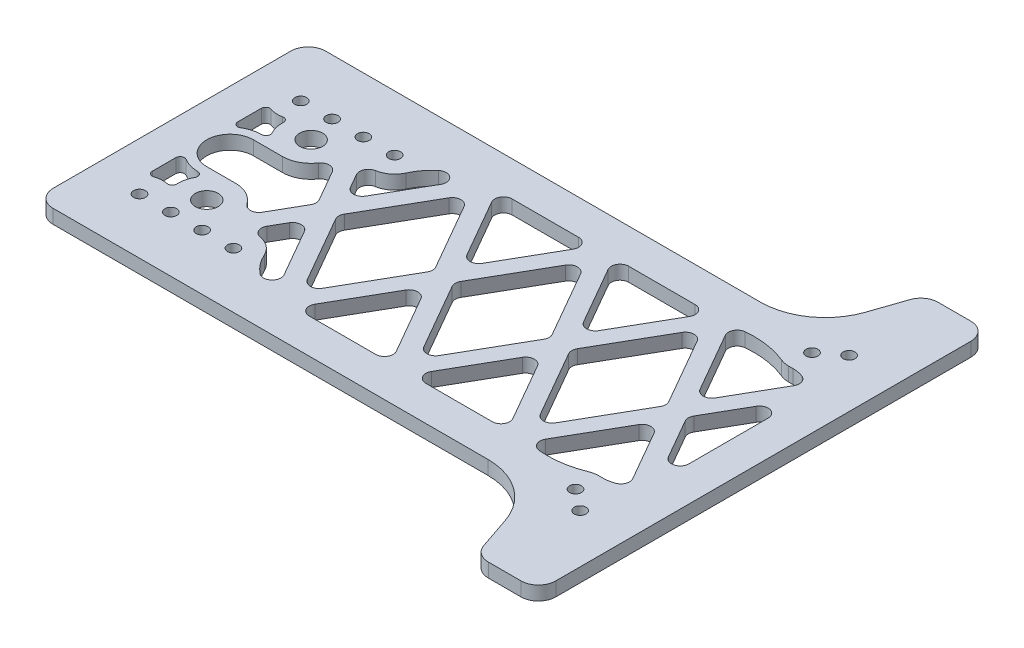
from build123d import *

# Parameters (mm, degrees)
SKETCH2_W               = 170
SKETCH2_H               = 149
BOSS_EXTRUDE1_DEPTH     = 4
M3_CLEARANCE_HOLE1_D    = 3.4
CUT_EXTRUDE4_DEPTH      = 114.09840847686584
CUT_EXTRUDE4_DEPTH_BACK = 114.09840847686584
M6_CLEARANCE_HOLE1_D    = 6.6
FILLET1_R               = 5
CUT_EXTRUDE5_DEPTH      = 10
FILLET2_R               = 2.5
FILLET3_R               = 1.25


with BuildPart() as part:
    # Sketch2 → Boss-Extrude1 (new body)
    with BuildSketch(Plane(origin=(0, 0, 0), x_dir=(1, 0, 0), z_dir=(0, 1, 0))):
        Rectangle(SKETCH2_W, SKETCH2_H)
    extrude(amount=BOSS_EXTRUDE1_DEPTH)

    # M3 Clearance Hole1 (through all)
    with Locations(Plane(origin=(0, 4, 0), x_dir=(1, 0, 0), z_dir=(0, 1, 0))):
        with Locations((-71.16, -23.18), (-62.16, -23.18), (-53.16, -23.18), (-44.16, -23.18), (71, -38.66), (65, -34)):
            m3_clearance_hole1 = Hole(M3_CLEARANCE_HOLE1_D / 2)

    # Mirror1: M3 Clearance Hole1 across plane
    add(m3_clearance_hole1.mirror(Plane.XY), mode=Mode.SUBTRACT)

    # Sketch12 → Cut-Extrude4 (cut, two sides: drawn at the far end of the back side and taken through both)
    with BuildSketch(Plane(origin=(0, 0, 0), x_dir=(1, 0, 0), z_dir=(0, 1, 0)).offset(-CUT_EXTRUDE4_DEPTH_BACK)):
        with BuildLine():
            Line((-85, 74.5), (-85, 39.16087466715528))
            Line((-85, 39.16087466715528), (45, 39.16087466715528))
            ThreePointArc((45.00000000000001, 39.160874667155284), (55.859105017335985, 42.64944779860569), (62.654667985072194, 51.80972226078975))
            Line((62.65466798507219, 51.80972226078975), (67.01941373117832, 64.6605523783211))
            Line((67.01941373117832, 64.6605523783211), (85, 64.6605523783211))
            Line((85, 64.66055237832109), (85, 74.5))
            Line((85, 74.5), (-85, 74.5))
        make_face()
        with BuildLine():
            Line((45, -39.16087466715528), (-85, -39.16087466715528))
            Line((-85, -39.16087466715527), (-85, -74.5))
            Line((-85, -74.5), (85, -74.5))
            Line((85, -74.5), (85, -64.6605523783211))
            Line((85, -64.6605523783211), (67.01941373117832, -64.6605523783211))
            Line((67.01941373117832, -64.6605523783211), (62.65466798507219, -51.80972226078975))
            ThreePointArc((62.654667985072194, -51.80972226078975), (55.859105017335985, -42.64944779860569), (45.00000000000001, -39.160874667155284))
        make_face()
    extrude(amount=CUT_EXTRUDE4_DEPTH + CUT_EXTRUDE4_DEPTH_BACK, mode=Mode.SUBTRACT)

    # M6 Clearance Hole1 (through all)
    with Locations(Plane(origin=(0, 4, 0), x_dir=(1, 0, 0), z_dir=(0, 1, 0))):
        with Locations((-60, -15), (-60, 15)):
            Hole(M6_CLEARANCE_HOLE1_D / 2)

    # Fillet1
    fillet1_edges = [part.edges().sort_by_distance(p)[0] for p in [
        (67.01941373117832, 2, 64.6605523783211),
        (85, 2, 64.6605523783211),
        (-85, 2, 39.16087466715527),
        (-85, 2, -39.16087466715528),
        (85, 2, -64.66055237832109),
        (67.01941373117832, 2, -64.6605523783211),
    ]]
    fillet(fillet1_edges, radius=FILLET1_R)

    # Sketch15 → Cut-Extrude5 (cut)
    with BuildSketch(Plane(origin=(0, 4, 0), x_dir=(1, 0, 0), z_dir=(0, 1, 0))):
        with BuildLine():
            ThreePointArc((62.469658143548614, -27.7961810076784), (63.710734171816135, -27.42521531726875), (65.00000000000001, -27.29999999999999))
            Line((65.00000000000001, -27.299999999999997), (66.24062764020537, -27.299999999999994))
            ThreePointArc((66.24062764020537, -27.299999999999997), (69.21314707767489, -26.780210902203514), (71.8328825180451, -25.28253312150752))
            Line((71.83288251804524, -25.282533121507466), (60.19274779943672, -5.019022315518903))
            Line((60.19274779943672, -5.01902231551891), (46.307592819814715, -29.190734651682497))
            ThreePointArc((46.30759281981484, -29.190734651682643), (47.684415937903765, -29.28693381897562), (49.05500720115354, -29.449339999262378))
            ThreePointArc((49.05500720115355, -29.449339999262378), (55.87235435865291, -29.515537620097643), (62.469658143548614, -27.796181007678403))
        make_face()
        with BuildLine():
            Line((63.07586595540194, 2.842e-14), (74.79873715280104, -20.40754105757501))
            ThreePointArc((74.79873715280098, -20.407541057575024), (74.94953893996781, -19.479492971551863), (75.00000000000001, -18.54062764020535))
            Line((75.00000000000001, -18.54062764020535), (75.00000000000001, 18.54062764020535))
            ThreePointArc((75.00000000000001, 18.54062764020535), (74.94953893996782, 19.47949297155183), (74.798737152801, 20.407541057574967))
            Line((74.79873715280097, 20.407541057574967), (63.07586595540193, 2.842e-14))
        make_face()
        Polygon((43.44162737968048, -24.14185235163639), (57.30962964347157, -6.75e-14), (43.4416273796805, 24.14185235163637), (29.573625115889378, -1.421e-14), align=None)
        Polygon((12.822504696133052, -29.160874667155273), (40.55850922371529, -29.160874667155273), (26.690506959924175, -5.019022315518896), align=None)
        with BuildLine():
            Line((46.307592819814715, 29.19073465168251), (60.19274779943678, 5.019022315518839))
            Line((60.19274779943679, 5.019022315518846), (71.83288251804535, 25.28253312150736))
            ThreePointArc((71.83288251804522, 25.282533121507406), (69.21314707767498, 26.780210902203486), (66.24062764020537, 27.299999999999997))
            Line((66.24062764020537, 27.299999999999994), (65.00000000000001, 27.299999999999997))
            ThreePointArc((65.00000000000001, 27.299999999999997), (63.710734171816135, 27.425215317268755), (62.469658143548614, 27.796181007678406))
            ThreePointArc((62.469658143548614, 27.796181007678403), (55.87235435865291, 29.515537620097643), (49.05500720115355, 29.449339999262378))
            ThreePointArc((49.05500720115355, 29.44933999926239), (47.684415937903765, 29.28693381897563), (46.30759281981484, 29.19073465168265))
        make_face()
        Polygon((26.69050695992418, 5.019022315518871), (40.558509223715305, 29.160874667155287), (12.822504696133038, 29.160874667155277), align=None)
        Polygon((-20.679736143379657, -29.160874667155273), (7.056268384202639, -29.160874667155273), (-6.811733879588491, -5.019022315518853), align=None)
        Polygon((9.939386540167854, -24.141852351636413), (23.807388803958972, -2.487e-14), (9.939386540167842, 24.1418523516364), (-3.9286157236232917, 2.842e-14), align=None)
        Polygon((-6.811733879588491, 5.01902231551891), (7.056268384202642, 29.160874667155273), (-20.6797361433796, 29.160874667155277), align=None)
        Polygon((-23.562854299344853, -24.141852351636384), (-9.694852035553694, 2.487e-14), (-23.562854299344824, 24.141852351636448), (-37.43085656313595, 1.776e-14), align=None)
        with BuildLine():
            Line((-26.531518202685646, -29.011953952897507), (-40.313974719101154, -5.019022315518875))
            Line((-40.31397471910114, -5.019022315518869), (-47.36719758840232, -17.297493422957626))
            ThreePointArc((-47.36719758840229, -17.29749342295765), (-42.04284894829164, -16.82329712632011), (-38.06611720812772, -20.39529309999725))
            ThreePointArc((-38.06611720812772, -20.39529309999725), (-33.40021711512526, -26.17799982520332), (-26.53151820268565, -29.011953952897507))
        make_face()
        with BuildLine():
            Line((-47.36719758840231, 17.29749342295762), (-40.31397471910115, 5.019022315518889))
            Line((-40.31397471910114, 5.019022315518903), (-26.531518202685643, 29.011953952897514))
            ThreePointArc((-26.531518202685646, 29.011953952897507), (-33.40021711512525, 26.17799982520332), (-38.06611720812772, 20.39529309999725))
            ThreePointArc((-38.06611720812772, 20.395293099997247), (-42.04284894829164, 16.82329712632011), (-47.367197588402284, 17.29749342295765))
        make_face()
        with BuildLine():
            Line((-51.70226587131497, -14.806071328432843), (-43.197092875066346, 0))
            Line((-43.197092875066346, 0), (-51.70226587131497, 14.806071328432845))
            ThreePointArc((-51.70226587131499, 14.806071328432834), (-54.19998310235253, 9.062845463776128), (-60.00000000000001, 6.700000000000005))
            Line((-60.00000000000001, 6.700000000000005), (-68.3, 6.7000000000000055))
            ThreePointArc((-68.3, 6.700000000000005), (-75.00000000000001, -2.846e-14), (-68.3, -6.700000000000063))
            Line((-68.3, -6.700000000000004), (-60.00000000000001, -6.700000000000005))
            ThreePointArc((-60.00000000000001, -6.700000000000005), (-54.19998310235253, -9.06284546377613), (-51.70226587131499, -14.806071328432838))
        make_face()
        with BuildLine():
            ThreePointArc((-65.93717104351911, 9.200000000000163), (-68.0469956190915, 12.96631823868085), (-67.97990138242557, 17.282799580944967))
            ThreePointArc((-67.97990138242568, 17.282799580945042), (-71.5476090955979, 16.491221397817846), (-75.0000000000001, 17.689608392837606))
            Line((-75.00000000000001, 17.68960839283763), (-75.00000000000001, 6.304760106459494))
            ThreePointArc((-74.99999999999983, 6.304760106459435), (-71.94939769143986, 8.445229214752757), (-68.3, 9.200000000000008))
            Line((-68.3, 9.200000000000005), (-65.93717104351917, 9.200000000000005))
        make_face()
        with BuildLine():
            ThreePointArc((-67.97990138242557, -17.282799580944975), (-68.0469956190915, -12.966318238680845), (-65.93717104351911, -9.200000000000152))
            Line((-65.93717104351916, -9.200000000000003), (-68.3, -9.200000000000003))
            ThreePointArc((-68.3, -9.200000000000001), (-71.94939769143986, -8.44522921475276), (-74.99999999999983, -6.304760106459449))
            Line((-75.00000000000001, -6.304760106459508), (-75.00000000000001, -17.68960839283763))
            ThreePointArc((-75.0000000000001, -17.689608392837606), (-71.5476090955979, -16.491221397817846), (-67.97990138242568, -17.282799580945046))
        make_face()
    extrude(amount=-CUT_EXTRUDE5_DEPTH, mode=Mode.SUBTRACT)

    # Fillet2
    # the kernel refuses this fillet: 2.5 mm, written as the material it adds along each edge
    with BuildSketch(Plane(origin=(7.056268384202641, 4, 29.160874667155273), x_dir=(-1, 0, 0), z_dir=(0, -1, 0))) as fillet2_piece_1:
        with BuildLine():
            CenterArc((FILLET2_R * 1.72768546463, FILLET2_R), FILLET2_R, 150.12529465141404, 119.87470534858596)
            Line((FILLET2_R * 0.860568730334, FILLET2_R * 1.49810497799), (0, 0))
            Line((0, 0), (FILLET2_R * 1.72768546463, 0))
        make_face()
    extrude(amount=4)
    with BuildSketch(Plane(origin=(-20.679736143379657, 4, 29.160874667155273), x_dir=(0.4981049779894329, 0, -0.867116734299452), z_dir=(0, -1, 0))) as fillet2_piece_2:
        with BuildLine():
            CenterArc((FILLET2_R * 1.72768546463, FILLET2_R), FILLET2_R, 150.12529465141395, 119.87470534858608)
            Line((FILLET2_R * 0.860568730334, FILLET2_R * 1.49810497799), (0, 0))
            Line((0, 0), (FILLET2_R * 1.72768546463, 8e-17))
        make_face()
    extrude(amount=4)
    with BuildSketch(Plane(origin=(-6.811733879588493, 4, 5.019022315518852), x_dir=(-0.4981049779894334, 0, 0.8671167342994517), z_dir=(0, -1, 0))) as fillet2_piece_3:
        with BuildLine():
            CenterArc((FILLET2_R * 1.74083129584, -FILLET2_R), FILLET2_R, 89.99999999999996, 120.25058930282808)
            Line((FILLET2_R * 0.877000972139, -FILLET2_R * 1.5037828618), (0, 0))
            Line((0, 0), (FILLET2_R * 1.74083129584, -2.3e-16))
        make_face()
    extrude(amount=4)
    with BuildSketch(Plane(origin=(12.822504696133056, 4, 29.160874667155277), x_dir=(1, 0, -8.2e-16), z_dir=(0, -1, 0))) as fillet2_piece_4:
        with BuildLine():
            CenterArc((FILLET2_R * 1.72768546463, -FILLET2_R), FILLET2_R, 90.00000000000004, 119.8747053485859)
            Line((FILLET2_R * 0.860568730334, -FILLET2_R * 1.49810497799), (0, 0))
            Line((0, 0), (FILLET2_R * 1.72768546463, 0))
        make_face()
    extrude(amount=4)
    with BuildSketch(Plane(origin=(26.69050695992418, 4, 5.019022315518896), x_dir=(0.49810497798943215, 0, 0.8671167342994527), z_dir=(0, -1, 0)), Plane(origin=(-23.562854299344824, 4, -24.141852351636448), x_dir=(0.49810497798943215, 0, 0.8671167342994527), z_dir=(0, -1, 0))) as fillet2_piece_5:
        with BuildLine():
            CenterArc((FILLET2_R * 1.74083129584, FILLET2_R), FILLET2_R, 149.74941069717198, 120.25058930282799)
            Line((FILLET2_R * 0.877000972139, FILLET2_R * 1.5037828618), (0, 0))
            Line((0, 0), (FILLET2_R * 1.74083129584, 5e-17))
        make_face()
    extrude(amount=4)
    with BuildSketch(Plane(origin=(40.55850922371529, 4, 29.160874667155277), x_dir=(-1, 0, -8.2e-16), z_dir=(0, -1, 0))) as fillet2_piece_6:
        with BuildLine():
            CenterArc((FILLET2_R * 1.72768546463, FILLET2_R), FILLET2_R, 150.12529465141404, 119.8747053485859)
            Line((FILLET2_R * 0.860568730334, FILLET2_R * 1.49810497799), (0, 0))
            Line((0, 0), (FILLET2_R * 1.72768546463, 0))
        make_face()
    extrude(amount=4)
    with BuildSketch(Plane(origin=(-40.31397471910115, 4, 5.019022315518872), x_dir=(0.4981049779894302, 0, 0.8671167342994536), z_dir=(0, -1, 0))) as fillet2_piece_7:
        with BuildLine():
            CenterArc((FILLET2_R * 1.74083129584, FILLET2_R), FILLET2_R, 149.74941069717187, 120.25058930282802)
            Line((FILLET2_R * 0.877000972139, FILLET2_R * 1.5037828618), (0, 0))
            Line((0, 0), (FILLET2_R * 1.74083129584, 3e-17))
        make_face()
    extrude(amount=4)
    with BuildSketch(Plane(origin=(-26.531518202685646, 4, 29.011953952897507), x_dir=(-0.9137848547416884, 0, -0.4061985219627363), z_dir=(0, -1, 0))) as fillet2_piece_8:
        with BuildLine():
            CenterArc((7.527377382643548, 2.404521549527619), FILLET2_R, 126.1590401297714, 159.72687653839708)
            Line((6.05230579950774, 4.422977351527062), (0, 0))
            ThreePointArc((0, 0), (4.105842208714662, -0.5728707028342952), (8.211684417429328, 1.9e-16))
        make_face()
    extrude(amount=4)
    with BuildSketch(Plane(origin=(-47.367197588402306, 4, 17.297493422957636), x_dir=(0.4981049779894286, 0, -0.8671167342994546), z_dir=(0, -1, 0))) as fillet2_piece_9:
        with BuildLine():
            CenterArc((5.118110883864309, 2.499999999999999), FILLET2_R, 159.5717071487415, 110.42829285125873)
            ThreePointArc((2.7753365109660844, 3.3725870946165397), (1.6702052988450595, 1.4537909164956615), (0, 0))
            Line((0, 0), (5.118110883864318, 0))
        make_face()
    extrude(amount=4)
    with BuildSketch(Plane(origin=(-40.31397471910114, 4, -5.019022315518896), x_dir=(-0.49810497798943437, 0, -0.8671167342994514), z_dir=(0, -1, 0))) as fillet2_piece_10:
        with BuildLine():
            CenterArc((FILLET2_R * 1.74083129584, FILLET2_R), FILLET2_R, 149.7494106971719, 120.25058930282825)
            Line((FILLET2_R * 0.877000972139, FILLET2_R * 1.5037828618), (0, 0))
            Line((0, 0), (FILLET2_R * 1.74083129584, -2.4e-16))
        make_face()
    extrude(amount=4)
    with BuildSketch(Plane(origin=(-47.3671975884023, 4, -17.297493422957636), x_dir=(0.49810497798942843, 0, 0.8671167342994546), z_dir=(0, -1, 0))) as fillet2_piece_11:
        with BuildLine():
            CenterArc((5.118110883864309, -2.4999999999999987), FILLET2_R, 89.99999999999973, 110.42829285125862)
            ThreePointArc((2.775336510966083, -3.3725870946165317), (1.6702052988450558, -1.4537909164956555), (0, 0))
            Line((0, 0), (5.11811088386432, 1.5e-16))
        make_face()
    extrude(amount=4)
    with BuildSketch(Plane(origin=(-26.531518202685646, 4, -29.01195395289751), x_dir=(-0.4981049779894321, 0, 0.8671167342994526), z_dir=(0, -1, 0))) as fillet2_piece_12:
        with BuildLine():
            CenterArc((7.496207984232875, 2.499999999999999), FILLET2_R, 110.27312346160294, 159.72687653839705)
            ThreePointArc((6.629968822619481, 4.845128933531658), (2.9769742934849805, 2.8850901443383785), (0, 0))
            Line((0, 0), (7.496207984232875, 9e-17))
        make_face()
    extrude(amount=4)
    with BuildSketch(Plane(origin=(71.8328825180453, 4, -25.282533121507385), x_dir=(-0.49810497798941095, 0, 0.8671167342994647), z_dir=(0, -1, 0))) as fillet2_piece_13:
        with BuildLine():
            CenterArc((2.454042856961975, 2.499999999999999), FILLET2_R, 170.72318428749443, 99.27681571250696)
            ThreePointArc((-0.01325971136638167, 2.903011211159556), (-0.1277319323630477, 1.4509524631818203), (0, 0))
            Line((0, 0), (2.4540428569620363, -6e-17))
        make_face()
    extrude(amount=4)
    with BuildSketch(Plane(origin=(60.19274779943679, 4, -5.019022315518843), x_dir=(-0.49810497798943326, 0, -0.8671167342994518), z_dir=(0, -1, 0))) as fillet2_piece_14:
        with BuildLine():
            CenterArc((FILLET2_R * 1.74083129584, FILLET2_R), FILLET2_R, 149.74941069717204, 120.25058930282808)
            Line((FILLET2_R * 0.877000972139, FILLET2_R * 1.5037828618), (0, 0))
            Line((0, 0), (FILLET2_R * 1.74083129584, 2e-17))
        make_face()
    extrude(amount=4)
    with BuildSketch(Plane(origin=(46.30759281981478, 4, -29.190734651682583), x_dir=(0.4981049779894106, 0, 0.8671167342994648), z_dir=(0, -1, 0))) as fillet2_piece_15:
        with BuildLine():
            CenterArc((3.853945877427777, -2.4999999999999987), FILLET2_R, 89.99999999999858, 114.1757772455515)
            Line((1.5732125361483829, -3.5238434577495346), (1.3451392020204431, -3.62622780352449))
            ThreePointArc((1.3451392020204431, -3.62622780352449), (0.9120356980031071, -2.603726623564733), (-0.22223757056452725, -0.11450092676295752))
            Line((-0.22223757056452725, -0.11450092676295752), (4.58e-15, 0.2500000000000006))
            Line((4.58e-15, 0.2500000000000006), (3.8539458774278437, 0.2500000000000008))
            Line((3.8539458774278437, 0.2500000000000008), (3.8539458774278392, 2.4e-16))
        make_face()
    extrude(amount=4)
    with BuildSketch(Plane(origin=(60.19274779943672, 4, 5.019022315518907), x_dir=(0.4981049779894305, 0, 0.8671167342994535), z_dir=(0, -1, 0))) as fillet2_piece_16:
        with BuildLine():
            CenterArc((FILLET2_R * 1.74083129584, FILLET2_R), FILLET2_R, 149.74941069717156, 120.25058930282853)
            Line((FILLET2_R * 0.877000972139, FILLET2_R * 1.5037828618), (0, 0))
            Line((0, 0), (FILLET2_R * 1.74083129584, -5e-17))
        make_face()
    extrude(amount=4)
    with BuildSketch(Plane(origin=(71.83288251804517, 4, 25.28253312150749), x_dir=(-0.8648325828533481, 0, 0.5020603585578202), z_dir=(0, -1, 0))) as fillet2_piece_17:
        with BuildLine():
            CenterArc((2.4887650226515405, 2.4654360680886573), FILLET2_R, 180.2617007515103, 99.27681571250866)
            Line((-0.01120889936936989, 2.4540172583707585), (0, 0))
            ThreePointArc((0, 0), (1.451520746670878, -0.1211033399319997), (2.9030414933417443, 6e-17))
        make_face()
    extrude(amount=4)
    with BuildSketch(Plane(origin=(46.30759281981478, 4, 29.19073465168257), x_dir=(0.49810497798940984, 0, -0.8671167342994653), z_dir=(0, -1, 0))) as fillet2_piece_18:
        with BuildLine():
            CenterArc((3.8539458774277557, 2.499999999999998), FILLET2_R, 155.82422275445012, 114.17577724555127)
            Line((1.5732125361483567, 3.5238434577495252), (1.345139202020417, 3.6262278035244804))
            ThreePointArc((1.345139202020417, 3.6262278035244804), (0.9120356980030954, 2.6037266235647394), (-0.22223757056452736, 0.11450092676295733))
            Line((-0.22223757056452736, 0.11450092676295733), (4.81e-15, -0.2500000000000006))
            Line((4.81e-15, -0.2500000000000006), (3.853945877427822, -0.2500000000000006))
            Line((3.853945877427822, -0.2500000000000006), (3.853945877427817, 1.1e-16))
        make_face()
    extrude(amount=4)
    with BuildSketch(Plane(origin=(-51.70226587131498, 4, -14.80607132843284), x_dir=(0.49810497798943365, 0, 0.8671167342994517), z_dir=(0, -1, 0))) as fillet2_piece_19:
        with BuildLine():
            CenterArc((5.470787903838961, 2.4999999999999996), FILLET2_R, 154.79946683536423, 115.20053316463583)
            ThreePointArc((3.208730177971799, 3.5644692784879606), (1.8674307996192583, 1.545423260452429), (0, 0))
            Line((0, 0), (5.470787903838964, 2e-16))
        make_face()
    extrude(amount=4)
    with BuildSketch(Plane(origin=(-43.197092875066346, 4, 0), x_dir=(-0.4981049779894303, 0, 0.8671167342994537), z_dir=(0, -1, 0))) as fillet2_piece_20:
        with BuildLine():
            CenterArc((FILLET2_R * 0.574438202247, FILLET2_R), FILLET2_R, 210.2505893028281, 59.74941069717204)
            Line((-FILLET2_R * 0.289392121458, FILLET2_R * 0.496217138196), (0, 0))
            Line((0, 0), (FILLET2_R * 0.574438202247, 4e-17))
        make_face()
    extrude(amount=4)
    with BuildSketch(Plane(origin=(-51.70226587131498, 4, 14.80607132843284), x_dir=(-0.3112038779753331, 0, -0.9503431729291867), z_dir=(0, -1, 0))) as fillet2_piece_21:
        with BuildLine():
            CenterArc((5.518262117920803, 2.393387450186638), FILLET2_R, 138.00650209395076, 115.2005331646358)
            Line((3.6602102289068106, 4.066003119649154), (0, 0))
            ThreePointArc((0, 0), (2.397988250195953, 0.3539536653803569), (4.795976500391908, -1e-16))
        make_face()
    extrude(amount=4)
    with BuildSketch(Plane(origin=(29.573625115889378, 4, 2.132e-14), x_dir=(0.4981049779894306, 0, 0.8671167342994535), z_dir=(0, -1, 0))) as fillet2_piece_22:
        with BuildLine():
            CenterArc((FILLET2_R * 0.574438202247, -FILLET2_R), FILLET2_R, 89.99999999999987, 59.74941069717191)
            Line((-FILLET2_R * 0.289392121458, -FILLET2_R * 0.496217138196), (0, 0))
            Line((0, 0), (FILLET2_R * 0.574438202247, -2e-17))
        make_face()
    extrude(amount=4)
    with BuildSketch(Plane(origin=(43.4416273796805, 4, -24.141852351636366), x_dir=(0.4981049779894306, 0, 0.8671167342994532), z_dir=(0, -1, 0))) as fillet2_piece_23:
        with BuildLine():
            CenterArc((FILLET2_R * 1.74083129584, FILLET2_R), FILLET2_R, 149.74941069717175, 120.25058930282822)
            Line((FILLET2_R * 0.877000972139, FILLET2_R * 1.5037828618), (0, 0))
            Line((0, 0), (FILLET2_R * 1.74083129584, -7e-17))
        make_face()
    extrude(amount=4)
    with BuildSketch(Plane(origin=(57.30962964347157, 4, 6.928e-14), x_dir=(-0.49810497798943243, 0, 0.8671167342994524), z_dir=(0, -1, 0))) as fillet2_piece_24:
        with BuildLine():
            CenterArc((FILLET2_R * 0.574438202247, FILLET2_R), FILLET2_R, 210.2505893028282, 59.74941069717181)
            Line((-FILLET2_R * 0.289392121458, FILLET2_R * 0.496217138196), (0, 0))
            Line((0, 0), (FILLET2_R * 0.574438202247, 6e-17))
        make_face()
    extrude(amount=4)
    with BuildSketch(Plane(origin=(43.44162737968048, 4, 24.141852351636388), x_dir=(-0.49810497798943215, 0, -0.8671167342994527), z_dir=(0, -1, 0))) as fillet2_piece_25:
        with BuildLine():
            CenterArc((FILLET2_R * 1.74083129584, FILLET2_R), FILLET2_R, 149.74941069717215, 120.25058930282782)
            Line((FILLET2_R * 0.877000972139, FILLET2_R * 1.5037828618), (0, 0))
            Line((0, 0), (FILLET2_R * 1.74083129584, 5e-17))
        make_face()
    extrude(amount=4)
    with BuildSketch(Plane(origin=(63.07586595540194, 4, -2.842e-14), x_dir=(0.49810497798943154, 0, -0.8671167342994529), z_dir=(0, -1, 0))) as fillet2_piece_26:
        with BuildLine():
            CenterArc((FILLET2_R * 0.574438202247, FILLET2_R), FILLET2_R, 210.25058930282802, 59.749410697171925)
            Line((-FILLET2_R * 0.289392121458, FILLET2_R * 0.496217138196), (0, 0))
            Line((0, 0), (FILLET2_R * 0.574438202247, 6e-17))
        make_face()
    extrude(amount=4)
    with BuildSketch(Plane(origin=(74.79873715280098, 4, -20.407541057574967), x_dir=(-0.4981049779894323, 0, 0.8671167342994525), z_dir=(0, -1, 0))) as fillet2_piece_27:
        with BuildLine():
            CenterArc((8.967043466576955, -2.4999999999999987), FILLET2_R, 89.99999999999996, 150.12529465141404)
            Line((7.721781021603375, -4.66779183574863), (7.597254777106017, -4.884571019323492))
            ThreePointArc((7.597254777106017, -4.884571019323492), (1.39405559511785, -1.3212164330409666), (-0.16786787267683226, -0.18525759720710946))
            Line((-0.16786787267683226, -0.18525759720710946), (-1.88e-15, 0.24999999999999448))
            Line((-1.88e-15, 0.24999999999999448), (8.967043466576955, 0.24999999999999475))
            Line((8.967043466576955, 0.24999999999999475), (8.967043466576957, -7e-17))
        make_face()
    extrude(amount=4)
    with BuildSketch(Plane(origin=(74.79873715280101, 4, 20.407541057575017), x_dir=(-0.49810497798942827, 0, -0.8671167342994548), z_dir=(0, -1, 0))) as fillet2_piece_28:
        with BuildLine():
            CenterArc((8.967043466577097, 2.4999999999999982), FILLET2_R, 119.87470534858579, 150.12529465141398)
            Line((7.721781021603525, 4.667791835748634), (7.597254777106168, 4.884571019323498))
            ThreePointArc((7.597254777106168, 4.884571019323498), (1.3940555951179134, 1.3212164330409601), (-0.1678678726768354, 0.18525759720712434))
            Line((-0.1678678726768354, 0.18525759720712434), (-3.04e-15, -0.24999999999999448))
            Line((-3.04e-15, -0.24999999999999448), (8.967043466577083, -0.2499999999999958))
            Line((8.967043466577083, -0.2499999999999958), (8.967043466577087, -1.6e-16))
        make_face()
    extrude(amount=4)
    with BuildSketch(Plane(origin=(-37.430856563135954, 4, -1.599e-14), x_dir=(0.4981049779894269, 0, 0.8671167342994556), z_dir=(0, -1, 0))) as fillet2_piece_29:
        with BuildLine():
            CenterArc((FILLET2_R * 0.574438202247, -FILLET2_R), FILLET2_R, 89.99999999999964, 59.749410697172024)
            Line((-FILLET2_R * 0.289392121458, -FILLET2_R * 0.496217138196), (0, 0))
            Line((0, 0), (FILLET2_R * 0.574438202247, 1e-17))
        make_face()
    extrude(amount=4)
    with BuildSketch(Plane(origin=(-9.69485203555369, 4, -2.487e-14), x_dir=(-0.49810497798943487, 0, 0.8671167342994509), z_dir=(0, -1, 0))) as fillet2_piece_30:
        with BuildLine():
            CenterArc((FILLET2_R * 0.574438202247, FILLET2_R), FILLET2_R, 210.2505893028279, 59.749410697171925)
            Line((-FILLET2_R * 0.289392121458, FILLET2_R * 0.496217138196), (0, 0))
            Line((0, 0), (FILLET2_R * 0.574438202247, -9e-17))
        make_face()
    extrude(amount=4)
    with BuildSketch(Plane(origin=(-23.562854299344853, 4, 24.141852351636384), x_dir=(-0.49810497798943143, 0, -0.8671167342994528), z_dir=(0, -1, 0))) as fillet2_piece_31:
        with BuildLine():
            CenterArc((FILLET2_R * 1.74083129584, FILLET2_R), FILLET2_R, 149.749410697172, 120.25058930282796)
            Line((FILLET2_R * 0.877000972139, FILLET2_R * 1.5037828618), (0, 0))
            Line((0, 0), (FILLET2_R * 1.74083129584, 2.1e-16))
        make_face()
    extrude(amount=4)
    with BuildSketch(Plane(origin=(7.056268384202641, 4, -29.160874667155277), x_dir=(-0.49810497798943276, 0, 0.8671167342994521), z_dir=(0, -1, 0))) as fillet2_piece_32:
        with BuildLine():
            CenterArc((FILLET2_R * 1.72768546463, FILLET2_R), FILLET2_R, 150.1252946514139, 119.87470534858613)
            Line((FILLET2_R * 0.860568730334, FILLET2_R * 1.49810497799), (0, 0))
            Line((0, 0), (FILLET2_R * 1.72768546463, -1.7e-16))
        make_face()
    extrude(amount=4)
    with BuildSketch(Plane(origin=(-6.811733879588489, 4, -5.019022315518905), x_dir=(0.49810497798943215, 0, -0.8671167342994526), z_dir=(0, -1, 0))) as fillet2_piece_33:
        with BuildLine():
            CenterArc((FILLET2_R * 1.74083129584, -FILLET2_R), FILLET2_R, 90.00000000000009, 120.25058930282773)
            Line((FILLET2_R * 0.877000972139, -FILLET2_R * 1.5037828618), (0, 0))
            Line((0, 0), (FILLET2_R * 1.74083129584, -5e-17))
        make_face()
    extrude(amount=4)
    with BuildSketch(Plane(origin=(40.558509223715305, 4, -29.160874667155284), x_dir=(-0.49810497798943243, 0, 0.8671167342994525), z_dir=(0, -1, 0))) as fillet2_piece_34:
        with BuildLine():
            CenterArc((FILLET2_R * 1.72768546463, FILLET2_R), FILLET2_R, 150.125294651414, 119.87470534858596)
            Line((FILLET2_R * 0.860568730334, FILLET2_R * 1.49810497799), (0, 0))
            Line((0, 0), (FILLET2_R * 1.72768546463, -5e-17))
        make_face()
    extrude(amount=4)
    with BuildSketch(Plane(origin=(26.690506959924175, 4, -5.019022315518866), x_dir=(0.49810497798943193, 0, -0.8671167342994527), z_dir=(0, -1, 0))) as fillet2_piece_35:
        with BuildLine():
            CenterArc((FILLET2_R * 1.74083129584, -FILLET2_R), FILLET2_R, 90.00000000000003, 120.25058930282799)
            Line((FILLET2_R * 0.877000972139, -FILLET2_R * 1.5037828618), (0, 0))
            Line((0, 0), (FILLET2_R * 1.74083129584, -9e-17))
        make_face()
    extrude(amount=4)
    with BuildSketch(Plane(origin=(12.822504696133038, 4, -29.160874667155277), x_dir=(1, 0, 0), z_dir=(0, -1, 0))) as fillet2_piece_36:
        with BuildLine():
            CenterArc((FILLET2_R * 1.72768546463, FILLET2_R), FILLET2_R, 150.12529465141392, 119.87470534858608)
            Line((FILLET2_R * 0.860568730334, FILLET2_R * 1.49810497799), (0, 0))
            Line((0, 0), (FILLET2_R * 1.72768546463, 0))
        make_face()
    extrude(amount=4)
    with BuildSketch(Plane(origin=(-3.9286157236232935, 4, -2.842e-14), x_dir=(0.4981049779894337, 0, -0.8671167342994516), z_dir=(0, -1, 0))) as fillet2_piece_37:
        with BuildLine():
            CenterArc((FILLET2_R * 0.574438202247, FILLET2_R), FILLET2_R, 210.2505893028279, 59.74941069717204)
            Line((-FILLET2_R * 0.289392121458, FILLET2_R * 0.496217138196), (0, 0))
            Line((0, 0), (FILLET2_R * 0.574438202247, 3e-17))
        make_face()
    extrude(amount=4)
    with BuildSketch(Plane(origin=(9.93938654016784, 4, -24.141852351636395), x_dir=(-0.49810497798943326, 0, 0.8671167342994519), z_dir=(0, -1, 0))) as fillet2_piece_38:
        with BuildLine():
            CenterArc((FILLET2_R * 1.74083129584, -FILLET2_R), FILLET2_R, 90.00000000000003, 120.2505893028279)
            Line((FILLET2_R * 0.877000972139, -FILLET2_R * 1.5037828618), (0, 0))
            Line((0, 0), (FILLET2_R * 1.74083129584, -3e-17))
        make_face()
    extrude(amount=4)
    with BuildSketch(Plane(origin=(23.80738880395898, 4, 2.665e-14), x_dir=(-0.49810497798943704, 0, 0.8671167342994498), z_dir=(0, -1, 0))) as fillet2_piece_39:
        with BuildLine():
            CenterArc((FILLET2_R * 0.574438202247, FILLET2_R), FILLET2_R, 210.25058930282776, 59.749410697171925)
            Line((-FILLET2_R * 0.289392121458, FILLET2_R * 0.496217138196), (0, 0))
            Line((0, 0), (FILLET2_R * 0.574438202247, -1e-17))
        make_face()
    extrude(amount=4)
    with BuildSketch(Plane(origin=(9.939386540167856, 4, 24.141852351636416), x_dir=(-0.49810497798943226, 0, -0.8671167342994524), z_dir=(0, -1, 0))) as fillet2_piece_40:
        with BuildLine():
            CenterArc((FILLET2_R * 1.74083129584, FILLET2_R), FILLET2_R, 149.74941069717198, 120.25058930282802)
            Line((FILLET2_R * 0.877000972139, FILLET2_R * 1.5037828618), (0, 0))
            Line((0, 0), (FILLET2_R * 1.74083129584, 2.5e-16))
        make_face()
    extrude(amount=4)
    with BuildSketch(Plane(origin=(-20.6797361433796, 4, -29.160874667155277), x_dir=(1, 0, 0), z_dir=(0, -1, 0))) as fillet2_piece_41:
        with BuildLine():
            CenterArc((FILLET2_R * 1.72768546463, FILLET2_R), FILLET2_R, 150.12529465141392, 119.87470534858608)
            Line((FILLET2_R * 0.860568730334, FILLET2_R * 1.49810497799), (0, 0))
            Line((0, 0), (FILLET2_R * 1.72768546463, 0))
        make_face()
    extrude(amount=4)

    # Fillet3
    fillet3_edges = [part.edges().sort_by_distance(p)[0] for p in [
        (-75.00000000000006, 2, 17.689608392837616),
        (-65.93717104351913, 2, 9.200000000000077),
        (-67.97990138242562, 2, 17.28279958094501),
        (-74.99999999999991, 2, -6.304760106459465),
        (-75.00000000000006, 2, -17.68960839283762),
        (-67.97990138242562, 2, -17.282799580945003),
        (-65.93717104351914, 2, -9.200000000000083),
        (-74.99999999999991, 2, 6.304760106459479),
    ]]
    fillet(fillet3_edges, radius=FILLET3_R)


solid = part.part
